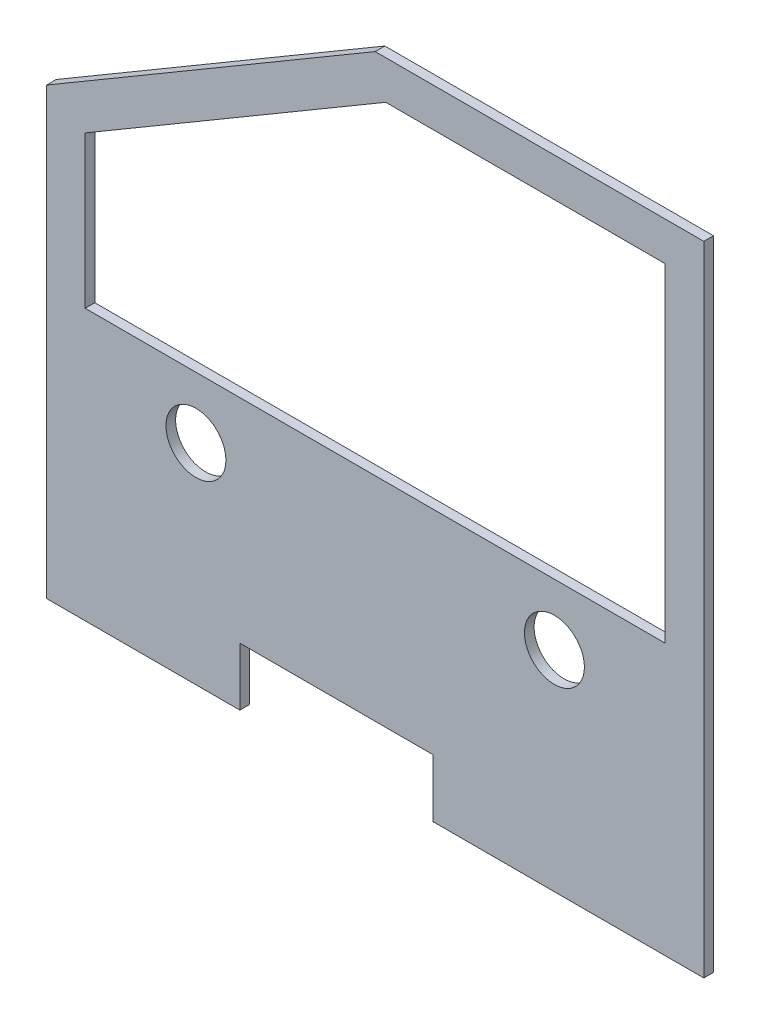
from build123d import *

# Parameters (mm, degrees)
FRAME_EXTERIOR_MASTER_OUTLINE_R = 19.685
FRAME_EXTERIOR_MASTER_DEPTH     = 6.35
CUT_EXTRUDE1_DEPTH              = 611.690430988


# Read off the part's stored shape, not the designer's step: Frame Exterior Master
with BuildPart() as part:
    # Frame Exterior Master outline → Frame Exterior Master (new body)
    with BuildSketch(Plane.XY):
        Polygon((431.8, 12.7), (431.8, 431.8), (215.9, 431.8), (0, 304.8), (0, 12.7), (127, 12.7), (127, 50.8), (254, 50.8), (254, 12.7), align=None)
        with Locations((98.15, 150.3)):
            Circle(FRAME_EXTERIOR_MASTER_OUTLINE_R, mode=Mode.SUBTRACT)
        with Locations((333.65, 150.3)):
            Circle(FRAME_EXTERIOR_MASTER_OUTLINE_R, mode=Mode.SUBTRACT)
    extrude(amount=FRAME_EXTERIOR_MASTER_DEPTH)

    # Sketch1 → Cut-Extrude1 (cut, through all)
    with BuildSketch(Plane(origin=(0, 0, 0), x_dir=(-1, 0, 0), z_dir=(0, 0, -1))):
        Polygon((-406.4, 406.4), (-406.4, 190.5), (-25.4, 190.5), (-25.4, 290.27257022), (-222.816630625, 406.4), align=None)
    extrude(amount=-CUT_EXTRUDE1_DEPTH, mode=Mode.SUBTRACT)


solid = part.part
